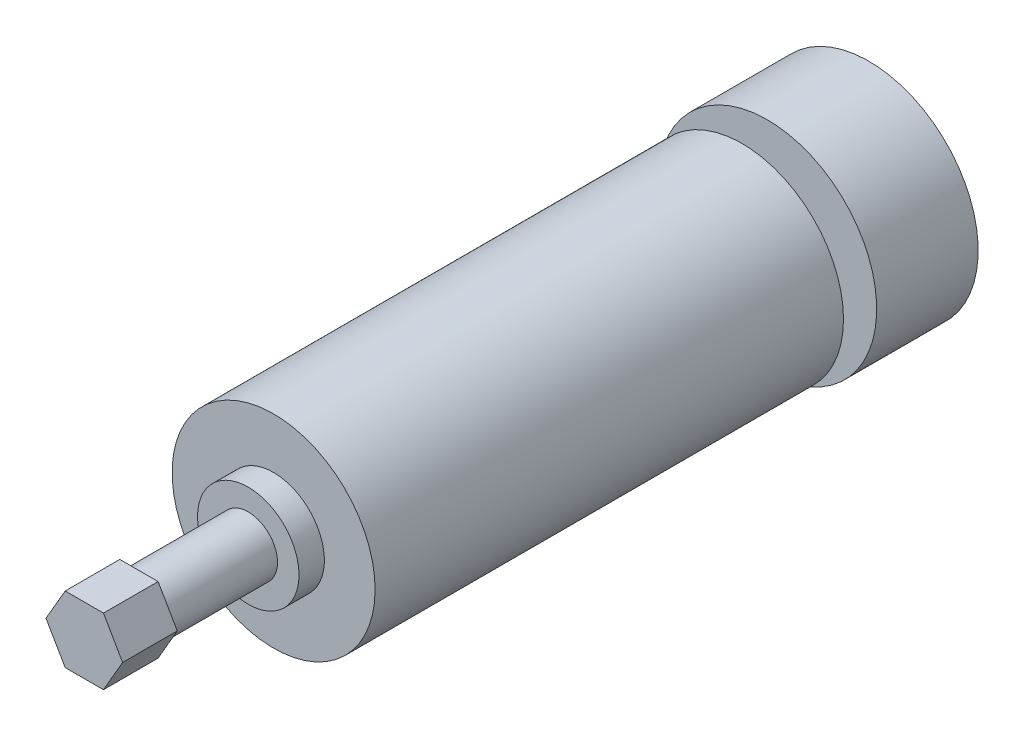
from build123d import *

# Parameters (mm, degrees)
ESQUISSE1_R        = 26
BOSS_EXTRU_1_DEPTH = 120
ESQUISSE2_R        = 13
BOSS_EXTRU_2_DEPTH = 6.5
BOSS_EXTRU_3_START = 6.5
ESQUISSE3_R        = 13
BOSS_EXTRU_3_DEPTH = 6.5
ESQUISSE4_R        = 7.5
BOSS_EXTRU_4_DEPTH = 28
BOSS_EXTRU_5_DEPTH = 14
ESQUISSE6_R        = 28
BOSS_EXTRU_6_DEPTH = 26


with BuildPart() as part:
    # Esquisse1 → Boss.-Extru.1 (new body)
    with BuildSketch(Plane.XY):
        Circle(ESQUISSE1_R)
    extrude(amount=BOSS_EXTRU_1_DEPTH)

    # Esquisse2 → Boss.-Extru.2 (add)
    with BuildSketch(Plane.XY.offset(120)):
        Circle(ESQUISSE2_R)
    extrude(amount=BOSS_EXTRU_2_DEPTH)

    # Esquisse3 → Boss.-Extru.3 (add)
    with BuildSketch(Plane(origin=(0, 0, 0), x_dir=(-1, 0, 0), z_dir=(0, 0, -1)).offset(BOSS_EXTRU_3_START)):
        Circle(ESQUISSE3_R)
    extrude(amount=-BOSS_EXTRU_3_DEPTH)

    # Esquisse4 → Boss.-Extru.4 (add)
    with BuildSketch(Plane.XY.offset(126.5)):
        Circle(ESQUISSE4_R)
    extrude(amount=BOSS_EXTRU_4_DEPTH)

    # Esquisse5 → Boss.-Extru.5 (add)
    with BuildSketch(Plane.XY.offset(154.5)):
        Polygon((9.814954576, 0), (4.907477288, 8.5), (-4.907477288, 8.5), (-9.814954576, 0), (-4.907477288, -8.5), (4.907477288, -8.5), align=None)
    extrude(amount=BOSS_EXTRU_5_DEPTH)

    # Esquisse6 → Boss.-Extru.6 (add)
    with BuildSketch(Plane(origin=(0, 0, -6.5), x_dir=(-1, 0, 0), z_dir=(0, 0, -1))):
        Circle(ESQUISSE6_R)
    extrude(amount=BOSS_EXTRU_6_DEPTH)


solid = part.part
